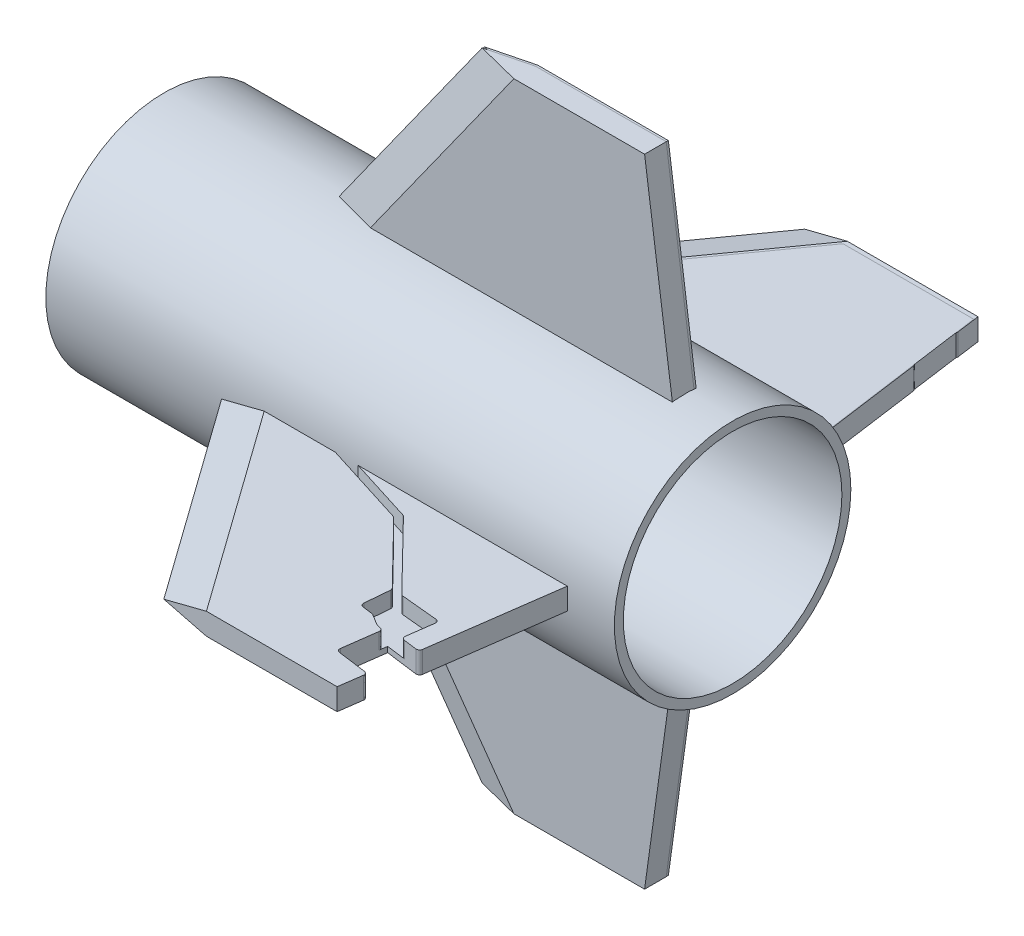
from build123d import *
from OCP.BRepAlgoAPI import BRepAlgoAPI_Cut
from OCP.TopTools import TopTools_ListOfShape

# Parameters (mm, degrees)
BOSS_EXTRUDE1_DEPTH         = 9.525
CUT_EXTRUDE11_DEPTH         = 109.249530891
CUT_EXTRUDE12_DEPTH         = 109.249530891
CIRPATTERN23_COUNT          = 4
CUT_EXTRUDE1_DEPTH          = 362.736725318
CUT_EXTRUDE8_DEPTH          = 7.112
FILLET16_START              = 2.413
FILLET16_DEPTH              = 8.587
FILLET16_START_2            = -1
FILLET16_2_DEPTH            = 3.8039695
FILLET16_3_DEPTH            = 9.525
BOSS_EXTRUDE7_DEPTH         = 128.5
BOSS_EXTRUDE7_DEPTH_BACK    = 121.5
SKETCH20_R                  = 52
CIRPATTERN6_COUNT           = 2
BOSS_EXTRUDE11_DEPTH        = 4.7625
BOSS_EXTRUDE11_DEPTH_BACK   = 4.7625
BOSS_EXTRUDE11_2_DEPTH      = 4.7625
BOSS_EXTRUDE11_2_DEPTH_BACK = 4.7625
CUT_EXTRUDE14_START         = 11
CUT_EXTRUDE14_DEPTH         = 154.474756751
CUT_EXTRUDE15_DEPTH         = 109.249530891
SKETCH24_R                  = 48.067269017
CUT_EXTRUDE16_DEPTH         = 250


with BuildPart() as part:
    # Sketch2 → Boss-Extrude1 (new body)
    with BuildSketch(Plane(origin=(0, 0, 0), x_dir=(1, 0, 0), z_dir=(0, 1, 0))):
        Polygon((95.501036211, 33.603610094), (107.801036211, 122.503610094), (-44.198963789, 122.503610094), (19.301036211, 33.603610094), align=None)
    extrude(amount=BOSS_EXTRUDE1_DEPTH)

    # Sketch40 → Cut-Extrude11 (cut, along a direction that is not the sketch's normal)
    with BuildSketch(Plane(origin=(0, 0, -122.503610094), x_dir=(-1, 0, 0), z_dir=(0, 0, -1))):
        Polygon((44.198963789, 4.7625), (25.464097027, 0), (44.198963789, 0), align=None)
    extrude(amount=-CUT_EXTRUDE11_DEPTH, dir=(-0.5812381937190959, 0, -0.8137334712067353), mode=Mode.SUBTRACT)

    # Sketch41 → Cut-Extrude12 (cut, along a direction that is not the sketch's normal)
    with BuildSketch(Plane(origin=(0, 0, -122.503610094), x_dir=(-1, 0, 0), z_dir=(0, 0, -1))):
        Polygon((44.198963789, 4.7625), (44.198963789, 9.525), (25.464097027, 9.525), align=None)
    extrude(amount=-CUT_EXTRUDE12_DEPTH, dir=(-0.5812381937190959, 0, -0.8137334712067353), mode=Mode.SUBTRACT)


with BuildPart() as cirpattern23_1:
    # CirPattern23: pattern copy
    add(part.part.rotate(Axis((0, 4.7625, -173.557610094), (1, 0, 0)), 1 * 360 / CIRPATTERN23_COUNT))


with BuildPart() as cirpattern23_2:
    # CirPattern23: pattern copy
    add(part.part.rotate(Axis((0, 4.7625, -173.557610094), (1, 0, 0)), 2 * 360 / CIRPATTERN23_COUNT))


with BuildPart() as cirpattern23_3:
    # CirPattern23: pattern copy
    add(part.part.rotate(Axis((0, 4.7625, -173.557610094), (1, 0, 0)), 3 * 360 / CIRPATTERN23_COUNT))


with BuildPart() as part_1:
    add(part.part)

    # Sketch3 → Cut-Extrude1 (cut, through all)
    with BuildSketch(Plane(origin=(0, 9.525, 0), x_dir=(1, 0, 0), z_dir=(0, 1, 0))):
        Polygon((97.113715989, 45.259482639), (81.457758718, 47.377913426), (84.139549011, 67.197297897), (99.863827857, 65.136307442), align=None)
    extrude(amount=-CUT_EXTRUDE1_DEPTH, mode=Mode.SUBTRACT)

    # Sketch4 → Cut-Extrude8 (cut)
    with BuildSketch(Plane(origin=(0, 9.525, 0), x_dir=(1, 0, 0), z_dir=(0, 1, 0))):
        Polygon((90.798797321, 64.276029848), (93.060356755, 80.621772423), (93.091292747, 80.881055605), (91.373825306, 81.047065282), (74.889192302, 82.640462942), (72.695204182, 84.888250805), (44.906464842, 113.35840998), (15.80661935, 122.503610094), (5.800372266, 122.503610094), (43.286879729, 110.722736122), (70.548347424, 82.792778051), (69.38755672, 69.89523129), (75.502445657, 69.097828811), (80.625476431, 66.005176824), (81.441822357, 65.706418579), (82.109879159, 65.569927762), (84.198801501, 65.189190125), (82.82828011, 55.283551775), (87.791261066, 54.596885119), (89.130306492, 64.506878411), align=None)
    extrude(amount=-CUT_EXTRUDE8_DEPTH, mode=Mode.SUBTRACT)


with BuildPart() as fillet16_tool:
    # Fillet16: read off the stored shape, not the designer's step
    # Fillet16 outline → Fillet16 (new body)
    with BuildSketch(Plane(origin=(0, 0, 0), x_dir=(1, 0, 0), z_dir=(0, 1, 0)).offset(FILLET16_START)):
        with BuildLine():
            Line((74.889192302, 82.640462942), (75.435167689, 82.587689192))
            add(Edge.make_bspline(
                [(74.506056062, 83.032994233), (74.889192302, 82.640462942), (75.435167689, 82.587689192)],
                knots=[0, 0, 0, 1, 1, 1], degree=2, weights=[1, 0.939175466, 1]))
            Line((74.506056062, 83.032994233), (74.889192302, 82.640462942))
        make_face()
        with BuildLine():
            add(Edge.make_bspline(
                [(98.387155652, 65.329855734), (99.863827857, 65.136307442), (100.067939942, 66.611556574)],
                knots=[0, 0, 0, 1, 1, 1], degree=2, weights=[1, 0.709632701, 1]))
            Line((98.387155652, 65.329855734), (99.863827857, 65.136307442))
            Line((99.863827857, 65.136307442), (100.067939942, 66.611556574))
        make_face()
        with BuildLine():
            Line((91.284221039, 67.784498833), (91.077166175, 66.287980345))
            Line((91.077166175, 66.287980345), (92.575128253, 66.091641576))
            add(Edge.make_bspline(
                [(92.575128253, 66.091641576), (91.077166175, 66.287980345), (91.284221039, 67.784498833)],
                knots=[0, 0, 0, 1, 1, 1], degree=2, weights=[1, 0.704571806, 1]))
        make_face()
        with BuildLine():
            add(Edge.make_bspline(
                [(83.683666479, 63.828163778), (83.875795136, 65.248062912), (82.466179182, 65.504986703)],
                knots=[0, 0, 0, 1, 1, 1], degree=2, weights=[1, 0.723109763, 1]))
            Line((83.683666479, 63.828163778), (83.875795136, 65.248062912))
            Line((83.875795136, 65.248062912), (82.466179182, 65.504986703))
        make_face()
        with BuildLine():
            add(Edge.make_bspline(
                [(96.907522133, 43.769187206), (97.113715989, 45.259482639), (95.622810652, 45.46121925)],
                knots=[0, 0, 0, 1, 1, 1], degree=2, weights=[1, 0.706048784, 1]))
            Line((96.907522133, 43.769187206), (97.113715989, 45.259482639))
            Line((97.113715989, 45.259482639), (95.622810652, 45.46121925))
        make_face()
        with BuildLine():
            Line((70.548347424, 82.792778051), (70.065901065, 83.287054688))
            add(Edge.make_bspline(
                [(70.486434226, 82.104860441), (70.548347424, 82.792778051), (70.065901065, 83.287054688)],
                knots=[0, 0, 0, 1, 1, 1], degree=2, weights=[1, 0.908329885, 1]))
            Line((70.486434226, 82.104860441), (70.548347424, 82.792778051))
        make_face()
        with BuildLine():
            add(Edge.make_bspline(
                [(43.550515551, 110.45263557), (43.286879729, 110.722736122), (42.926806229, 110.835896318)],
                knots=[0, 0, 0, 1, 1, 1], degree=2, weights=[1, 0.969770756, 1]))
            Line((43.550515551, 110.45263557), (43.286879729, 110.722736122))
            Line((43.286879729, 110.722736122), (42.926806229, 110.835896318))
        make_face()
    extrude(amount=FILLET16_DEPTH)


with BuildPart() as part_2:
    add(part_1.part)

    # Fillet16: cut by fillet16_tool, with a tolerance
    fillet16_stock = TopTools_ListOfShape()
    fillet16_stock.Append(part_2.part.wrapped)
    fillet16_tools = TopTools_ListOfShape()
    fillet16_tools.Append(fillet16_tool.part.wrapped)
    fillet16_cut = BRepAlgoAPI_Cut()
    fillet16_cut.SetArguments(fillet16_stock)
    fillet16_cut.SetTools(fillet16_tools)
    fillet16_cut.SetFuzzyValue(0.00001)
    fillet16_cut.Build()
    add(Compound.cast(fillet16_cut.Shape()).solids(), mode=Mode.REPLACE)


with BuildPart() as fillet16_2_tool:
    # Fillet16 2 outline → Fillet16 2 (new body)
    with BuildSketch(Plane(origin=(0, 0, 0), x_dir=(1, 0, 0), z_dir=(0, 1, 0)).offset(FILLET16_START_2)):
        with BuildLine():
            add(Edge.make_bspline(
                [(98.387155652, 65.329855734), (99.863827857, 65.136307442), (100.067939942, 66.611556574)],
                knots=[0, 0, 0, 1, 1, 1], degree=2, weights=[1, 0.709632701, 1]))
            Line((98.387155652, 65.329855734), (99.863827857, 65.136307442))
            Line((99.863827857, 65.136307442), (100.067939942, 66.611556574))
        make_face()
        with BuildLine():
            add(Edge.make_bspline(
                [(96.907522133, 43.769187206), (97.113715989, 45.259482639), (95.622810652, 45.46121925)],
                knots=[0, 0, 0, 1, 1, 1], degree=2, weights=[1, 0.706048784, 1]))
            Line((96.907522133, 43.769187206), (97.113715989, 45.259482639))
            Line((97.113715989, 45.259482639), (95.622810652, 45.46121925))
        make_face()
    extrude(amount=FILLET16_2_DEPTH)


with BuildPart() as part_3:
    add(part_2.part)

    # Fillet16 2: cut by fillet16_2_tool, with a tolerance
    fillet16_2_stock = TopTools_ListOfShape()
    fillet16_2_stock.Append(part_3.part.wrapped)
    fillet16_2_tools = TopTools_ListOfShape()
    fillet16_2_tools.Append(fillet16_2_tool.part.wrapped)
    fillet16_2_cut = BRepAlgoAPI_Cut()
    fillet16_2_cut.SetArguments(fillet16_2_stock)
    fillet16_2_cut.SetTools(fillet16_2_tools)
    fillet16_2_cut.SetFuzzyValue(0.00001)
    fillet16_2_cut.Build()
    add(Compound.cast(fillet16_2_cut.Shape()).solids(), mode=Mode.REPLACE)


with BuildPart() as fillet16_3_tool:
    # Fillet16 3 outline → Fillet16 3 (new body)
    with BuildSketch(Plane(origin=(0, 0, 0), x_dir=(1, 0, 0), z_dir=(0, 1, 0))):
        with BuildLine():
            add(Edge.make_bspline(
                [(45.170100664, 113.088309428), (44.906464842, 113.35840998), (44.546391342, 113.471570175)],
                knots=[0, 0, 0, 1, 1, 1], degree=2, weights=[1, 0.969770756, 1]))
            Line((45.170100664, 113.088309428), (44.906464842, 113.35840998))
            Line((44.906464842, 113.35840998), (44.546391342, 113.471570175))
        make_face()
        with BuildLine():
            add(Edge.make_bspline(
                [(92.881954146, 79.332342186), (93.096165416, 80.880584615), (91.540425146, 81.030961812)],
                knots=[0, 0, 0, 1, 1, 1], degree=2, weights=[1, 0.692418572, 1]))
            Line((92.881954146, 79.332342186), (93.060356755, 80.621772423))
            Line((93.060356755, 80.621772423), (93.091292747, 80.881055605))
            Line((93.091292747, 80.881055605), (91.540425146, 81.030961812))
        make_face()
        with BuildLine():
            Line((81.457758718, 47.377913426), (82.944212554, 47.176779154))
            add(Edge.make_bspline(
                [(81.65889299, 48.864367261), (81.457758718, 47.377913426), (82.944212554, 47.176779154)],
                knots=[0, 0, 0, 1, 1, 1], degree=2, weights=[1, 0.707106781, 1]))
            Line((81.65889299, 48.864367261), (81.457758718, 47.377913426))
        make_face()
        with BuildLine():
            add(Edge.make_bspline(
                [(69.516752337, 71.33072393), (69.38755672, 69.89523129), (70.816750957, 69.708859462)],
                knots=[0, 0, 0, 1, 1, 1], degree=2, weights=[1, 0.721076297, 1]))
            Line((69.516752337, 71.33072393), (69.38755672, 69.89523129))
            Line((69.38755672, 69.89523129), (70.816750957, 69.708859462))
        make_face()
    extrude(amount=FILLET16_3_DEPTH)


with BuildPart() as part_4:
    add(part_3.part)


with BuildPart() as part_5:
    # Fillet16 3: joined with fillet16_3_tool
    add(part_4.part.fuse(fillet16_3_tool.part, tol=0.00001))


with BuildPart() as body_5:
    # Sketch20 → Boss-Extrude7 (new, two sides: drawn at the far end of the back side and taken through both)
    with BuildSketch(Plane(origin=(0, 0, 0), x_dir=(0, 0, -1), z_dir=(1, 0, 0)).offset(-BOSS_EXTRUDE7_DEPTH_BACK)):
        with Locations((174.503610094, 4.7625)):
            Circle(SKETCH20_R)
    extrude(amount=BOSS_EXTRUDE7_DEPTH + BOSS_EXTRUDE7_DEPTH_BACK)

    # Sketch24 → Cut-Extrude16 (cut)
    with BuildSketch(Plane(origin=(128.5, 0, 0), x_dir=(0, 0, -1), z_dir=(1, 0, 0))):
        with Locations((174.503610094, 4.7625)):
            Circle(SKETCH24_R)
    extrude(amount=-CUT_EXTRUDE16_DEPTH, mode=Mode.SUBTRACT)


with BuildPart() as cirpattern6_1:
    # CirPattern6: pattern copy
    add(part_5.part.rotate(Axis((128.5, 4.7625, -174.503610094), (1, 0, 0)), 1 * 360 / CIRPATTERN6_COUNT))


with BuildPart() as body_7:
    # Sketch35 → Boss-Extrude11 (new, two sides: drawn at the far end of the back side and taken through both)
    with BuildSketch(Plane(origin=(0, 0, -174.503610094), x_dir=(-1, 0, 0), z_dir=(0, 0, -1)).offset(-BOSS_EXTRUDE11_DEPTH_BACK)):
        Polygon((44.198963789, -46.2375), (-107.801036211, -46.2375), (-95.501036211, -135.1375), (-19.301036211, -135.1375), align=None)
    extrude(amount=BOSS_EXTRUDE11_DEPTH + BOSS_EXTRUDE11_DEPTH_BACK)

    # Cut-Extrude14: read off the stored shape, not the designer's step
    # Cut-Extrude14 outline → Cut-Extrude14 (cut)
    with BuildSketch(Plane(origin=(0, 0, 0), x_dir=(0.8137334712067363, 0.5812381937190946, 0), z_dir=(0.5812381937190946, -0.8137334712067362, 0)).offset(CUT_EXTRUDE14_START)):
        Polygon((-62.84117721, -179.266110094), (-47.595989016, -179.266110094), (-62.84117721, -174.503610094), align=None)
        Polygon((-62.84117721, -169.741110094), (-62.84117721, -174.503610094), (-47.595989016, -169.741110094), align=None)
    extrude(amount=CUT_EXTRUDE14_DEPTH, mode=Mode.SUBTRACT)


with BuildPart() as body_8:
    # Sketch35 → Boss-Extrude11 2 (new, two sides: drawn at the far end of the back side and taken through both)
    with BuildSketch(Plane(origin=(0, 0, -174.503610094), x_dir=(-1, 0, 0), z_dir=(0, 0, -1)).offset(-BOSS_EXTRUDE11_2_DEPTH_BACK)):
        Polygon((-95.501036211, 144.6625), (-107.801036211, 55.7625), (44.198963789, 55.7625), (-19.301036211, 144.6625), align=None)
    extrude(amount=BOSS_EXTRUDE11_2_DEPTH + BOSS_EXTRUDE11_2_DEPTH_BACK)

    # Sketch44 → Cut-Extrude15 (cut, along a direction that is not the sketch's normal)
    with BuildSketch(Plane.XZ.offset(-55.7625)):
        Polygon((-44.198963789, -169.741110094), (-44.198963789, -174.503610094), (-25.464096989, -169.741110094), align=None)
        Polygon((-25.464096989, -179.266110094), (-44.198963789, -174.503610094), (-44.198963789, -179.266110094), align=None)
    extrude(amount=-CUT_EXTRUDE15_DEPTH, dir=(-0.5812381937190975, -0.8137334712067342, 0), mode=Mode.SUBTRACT)


solid = Compound([cirpattern23_1.part, cirpattern23_2.part, cirpattern23_3.part, part_5.part, body_5.part, cirpattern6_1.part, body_7.part, body_8.part])
